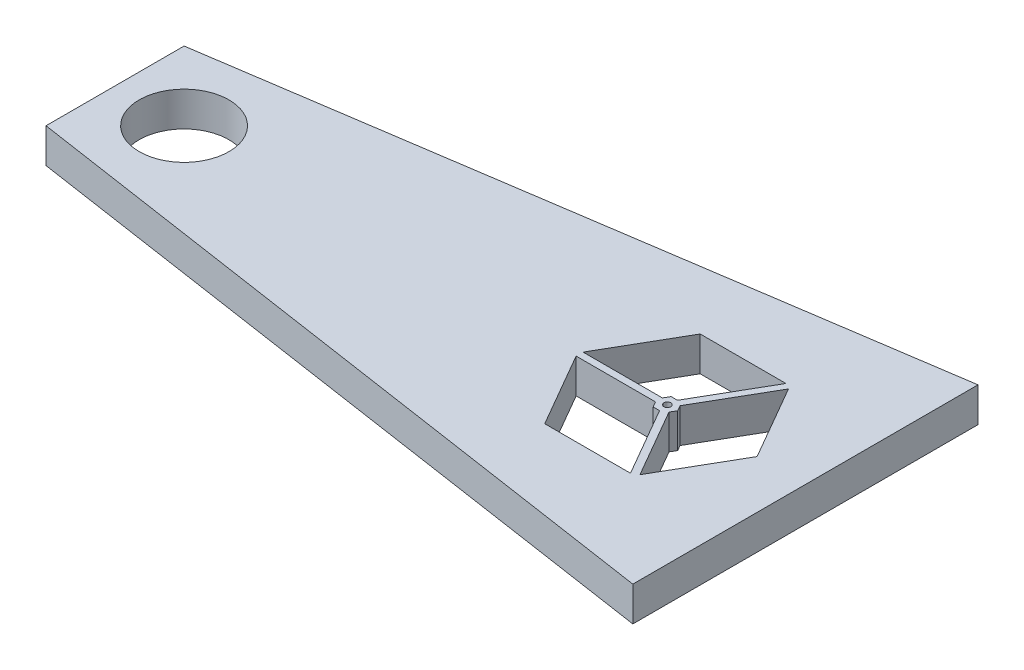
from build123d import *

# Parameters (mm, degrees)
SKETCH1_W           = 100
SKETCH1_H           = 50
BOSS_EXTRUDE1_DEPTH = 5
CUT_EXTRUDE1_DEPTH  = 10
CUT_EXTRUDE2_DEPTH  = 57.124860802
EXTRUDE_THIN2_START = -5
EXTRUDE_THIN2_DEPTH = 5
BOSS_EXTRUDE3_DEPTH = 5
SKETCH7_R           = 6.5
CUT_EXTRUDE3_DEPTH  = 57.124860802
SKETCH8_R           = 0.5
CUT_EXTRUDE4_DEPTH  = 57.124860802


# Read off the part's stored shape, not the designer's step: Extrude-Thin2
with BuildPart() as part:
    # Sketch1 → Boss-Extrude1 (new body)
    with BuildSketch(Plane(origin=(0, 0, 0), x_dir=(1, 0, 0), z_dir=(0, 1, 0))):
        Rectangle(SKETCH1_W, SKETCH1_H)
    extrude(amount=BOSS_EXTRUDE1_DEPTH)

    # Sketch2 → Cut-Extrude1 (cut)
    with BuildSketch(Plane(origin=(0, 5, 0), x_dir=(1, 0, 0), z_dir=(0, 1, 0))):
        Polygon((23.5, -11.258330249), (36.5, -11.258330249), (43, 0), (36.5, 11.258330249), (23.5, 11.258330249), (17, 0), align=None)
    extrude(amount=-CUT_EXTRUDE1_DEPTH, mode=Mode.SUBTRACT)

    # Sketch3 → Cut-Extrude2 (cut, through all)
    with BuildSketch(Plane(origin=(0, 5, 0), x_dir=(1, 0, 0), z_dir=(0, 1, 0))):
        Polygon((50, -25), (-50, -10), (-50, -25), align=None)
    cut_extrude2 = extrude(amount=-CUT_EXTRUDE2_DEPTH, mode=Mode.SUBTRACT)

    # Mirror1: Cut-Extrude2 across plane
    add(cut_extrude2.mirror(Plane.XY), mode=Mode.SUBTRACT)

    # Extrude-Thin2 outline → Extrude-Thin2 (add)
    with BuildSketch(Plane(origin=(0, 5, 0), x_dir=(1, 0, 0), z_dir=(0, 1, 0)).offset(EXTRUDE_THIN2_START)):
        Polygon((17, 0), (17.288675135, -0.5), (29.711324865, -0.5), (35.922649731, -11.258330249), (36.5, -11.258330249), (36.788675135, -10.758330249), (30.577350269, 0), (36.788675135, 10.758330249), (36.5, 11.258330249), (35.922649731, 11.258330249), (29.711324865, 0.5), (17.288675135, 0.5), align=None)
    extrude(amount=EXTRUDE_THIN2_DEPTH)

    # Sketch6 → Boss-Extrude3 (add, through all)
    with BuildSketch(Plane(origin=(0, 5, 0), x_dir=(1, 0, 0), z_dir=(0, 1, 0))):
        Polygon((31.5, 0), (30.75, 1.299038106), (29.25, 1.299038106), (28.5, 0), (29.25, -1.299038106), (30.75, -1.299038106), align=None)
    extrude(amount=-BOSS_EXTRUDE3_DEPTH)

    # Sketch7 → Cut-Extrude3 (cut, through all)
    with BuildSketch(Plane(origin=(0, 5, 0), x_dir=(1, 0, 0), z_dir=(0, 1, 0))):
        with Locations(Location((-40, 0, 0), (0, 0, 270))):
            Circle(SKETCH7_R)
    extrude(amount=-CUT_EXTRUDE3_DEPTH, mode=Mode.SUBTRACT)

    # Sketch8 → Cut-Extrude4 (cut, through all)
    with BuildSketch(Plane(origin=(0, 5, 0), x_dir=(1, 0, 0), z_dir=(0, 1, 0))):
        with Locations(Location((30, 0, 0), (0, 0, 270))):
            Circle(SKETCH8_R)
    extrude(amount=-CUT_EXTRUDE4_DEPTH, mode=Mode.SUBTRACT)


solid = part.part
